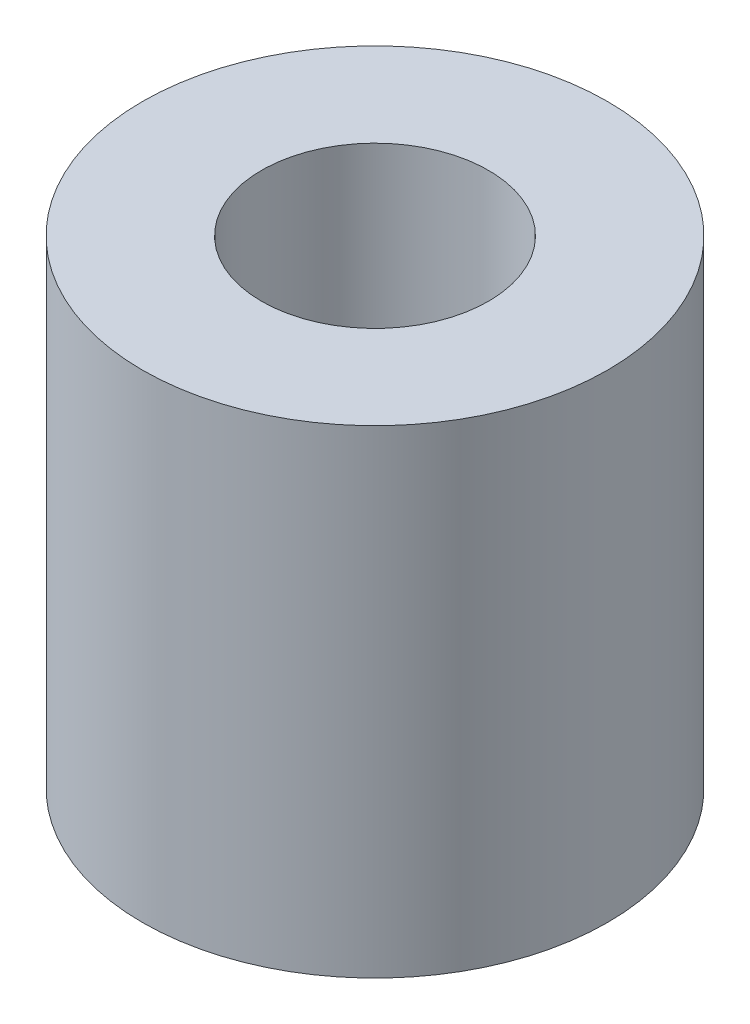
from build123d import *

# Parameters (mm, degrees)
SKETCH1_R           = 12.35
SKETCH1_R_2         = 6.025
BOSS_EXTRUDE1_DEPTH = 25.4


with BuildPart() as part:
    # Sketch1 → Boss-Extrude1 (new body)
    with BuildSketch(Plane(origin=(0, 0, 0), x_dir=(1, 0, 0), z_dir=(0, 1, 0))):
        Circle(SKETCH1_R)
        Circle(SKETCH1_R_2, mode=Mode.SUBTRACT)
    extrude(amount=BOSS_EXTRUDE1_DEPTH)


solid = part.part
